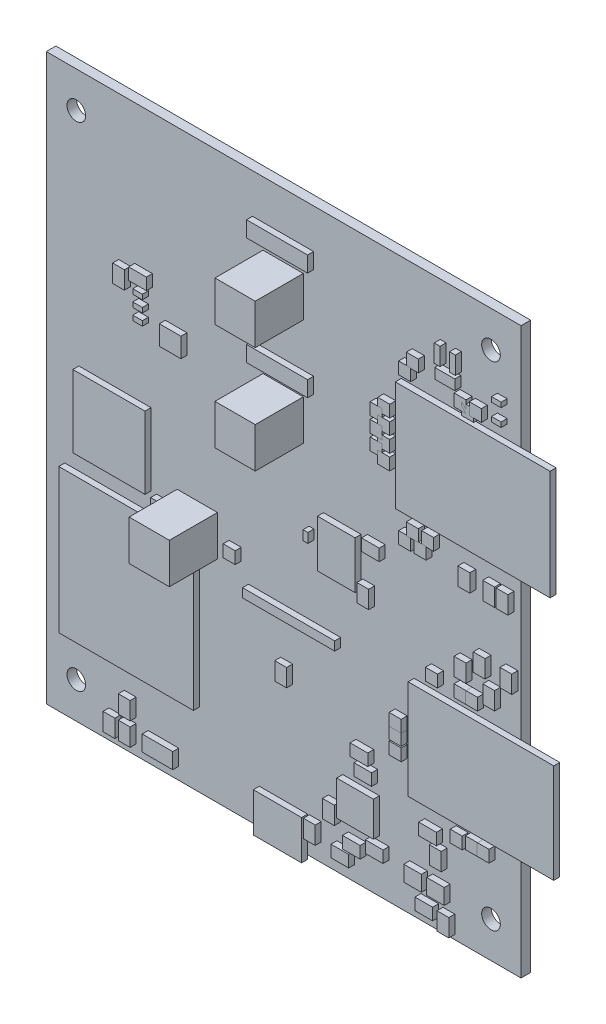
from build123d import *

# Parameters (mm, degrees)
SKETCH1_W                     = 79
SKETCH1_H                     = 94
BOARD_DEPTH                   = 1.6
SKETCH2_W                     = 22.4041
SKETCH2_H                     = 23.9616
BATTCOM_20MM_PTH_KIT_1_DEPTH  = 1
SKETCH3_W                     = 1.6
SKETCH3_H                     = 0.8008
C0603K_1_DEPTH                = 1
SKETCH4_W                     = 0.8008
SKETCH4_H                     = 1.6
C0603K_2_DEPTH                = 1
SKETCH5_W                     = 0.8008
SKETCH5_H                     = 1.6
C0603K_3_DEPTH                = 1
SKETCH6_W                     = 0.8008
SKETCH6_H                     = 1.6
C0603K_4_DEPTH                = 1
SKETCH7_W                     = 0.8008
SKETCH7_H                     = 1.6
C0603K_5_DEPTH                = 1
SKETCH8_W                     = 1.6
SKETCH8_H                     = 0.8008
C0603K_6_DEPTH                = 1
SKETCH9_W                     = 0.966
SKETCH9_H                     = 2.946
EXTRUDE_C0402_1_DEPTH         = 1
SKETCH10_W                    = 0.966
SKETCH10_H                    = 2.946
EXTRUDE_C0402_2_DEPTH         = 1
SKETCH11_W                    = 1.6
SKETCH11_H                    = 0.8008
C0603K_7_DEPTH                = 1
SKETCH12_W                    = 0.8008
SKETCH12_H                    = 1.6
C0603K_8_DEPTH                = 1
SKETCH13_W                    = 0.8008
SKETCH13_H                    = 1.6
C0603K_9_DEPTH                = 1
SKETCH14_W                    = 0.8008
SKETCH14_H                    = 1.6
C0603K_10_DEPTH               = 1
SKETCH15_W                    = 1.6
SKETCH15_H                    = 0.8008
C0603K_11_DEPTH               = 1
SKETCH16_W                    = 6.7016
SKETCH16_H                    = 6.7016
F_153CLV_0605_1_DEPTH         = 8
SKETCH17_W                    = 6.7016
SKETCH17_H                    = 6.7016
F_153CLV_0605_2_DEPTH         = 8
SKETCH18_W                    = 1.6
SKETCH18_H                    = 0.8008
C0603K_12_DEPTH               = 1
SKETCH19_W                    = 0.8008
SKETCH19_H                    = 1.6
C0603K_13_DEPTH               = 1
SKETCH20_W                    = 0.8008
SKETCH20_H                    = 1.6
C0603K_14_DEPTH               = 1
SKETCH21_W                    = 1.6
SKETCH21_H                    = 0.8008
C0603K_15_DEPTH               = 1
SKETCH22_W                    = 0.8008
SKETCH22_H                    = 1.6
C0603K_16_DEPTH               = 1
SKETCH23_W                    = 1.6
SKETCH23_H                    = 0.8008
C0603K_17_DEPTH               = 1
SKETCH24_W                    = 0.8008
SKETCH24_H                    = 1.6
C0603K_18_DEPTH               = 1
SKETCH25_W                    = 6.7016
SKETCH25_H                    = 6.7016
F_153CLV_0605_3_DEPTH         = 8
SKETCH26_W                    = 1.6
SKETCH26_H                    = 0.8008
C0603K_19_DEPTH               = 1
SKETCH27_W                    = 1.6
SKETCH27_H                    = 0.8008
C0603K_20_DEPTH               = 1
SKETCH28_W                    = 1.6
SKETCH28_H                    = 0.8008
C0603K_21_DEPTH               = 1
SKETCH29_W                    = 1.6
SKETCH29_H                    = 0.8008
C0603K_22_DEPTH               = 1
SKETCH30_W                    = 1.6
SKETCH30_H                    = 0.8008
C0603K_23_DEPTH               = 1
SKETCH31_W                    = 0.966
SKETCH31_H                    = 2.946
EXTRUDE_C0402_3_DEPTH         = 1
SKETCH32_W                    = 0.966
SKETCH32_H                    = 2.946
EXTRUDE_C0402_4_DEPTH         = 1
SKETCH33_W                    = 0.8008
SKETCH33_H                    = 1.6
C0603K_24_DEPTH               = 1
SKETCH34_W                    = 5.6242
SKETCH34_H                    = 5.676903
WS2812B_1_DEPTH               = 1
SKETCH35_W                    = 2.921
SKETCH35_H                    = 2.5908
SOT23_1_DEPTH                 = 1
SKETCH36_W                    = 2.921
SKETCH36_H                    = 2.5908
SOT23_2_DEPTH                 = 1
SKETCH37_W                    = 6.10435
SKETCH37_H                    = 5.77935
MLP28_1_DEPTH                 = 1
SKETCH38_W                    = 2.2
SKETCH38_H                    = 2.4032
SC70_5L_1_DEPTH               = 1
SKETCH39_W                    = 15.3416
SKETCH39_H                    = 1.4732
F_1X06_LONGPADS_1_DEPTH       = 1
SKETCH40_W                    = 8.04
SKETCH40_H                    = 6.534
USB_MICROB_PTH_MILL_1_DEPTH   = 1
SKETCH41_W                    = 2.9914
SKETCH41_H                    = 4.9968
L3225M_1_DEPTH                = 1
SKETCH42_W                    = 10.16
SKETCH42_H                    = 2.6162
EXTRUDE_1X04_1_DEPTH          = 1
SKETCH43_W                    = 10.16
SKETCH43_H                    = 2.6162
EXTRUDE_1X04_2_DEPTH          = 1
SKETCH44_W                    = 5.08
SKETCH44_H                    = 2.6162
EXTRUDE_1X02_1_DEPTH          = 1
SKETCH45_W                    = 12.0032
SKETCH45_H                    = 12.0032
BUZZER_12MM_NS_KIT_1_DEPTH    = 1
SKETCH46_W                    = 1.966
SKETCH46_H                    = 2.946
EXTRUDE_R0603_1_DEPTH         = 1
SKETCH47_W                    = 2.946
SKETCH47_H                    = 1.966
EXTRUDE_R0603_2_DEPTH         = 1
SKETCH48_W                    = 2.946
SKETCH48_H                    = 1.966
EXTRUDE_R0603_3_DEPTH         = 1
SKETCH49_W                    = 2.946
SKETCH49_H                    = 1.966
EXTRUDE_R0603_4_DEPTH         = 1
SKETCH50_W                    = 2.946
SKETCH50_H                    = 1.966
EXTRUDE_R0603_5_DEPTH         = 1
SKETCH51_W                    = 2.946
SKETCH51_H                    = 1.966
EXTRUDE_R0603_6_DEPTH         = 1
SKETCH52_W                    = 2.946
SKETCH52_H                    = 1.966
EXTRUDE_R0603_7_DEPTH         = 1
SKETCH53_W                    = 1.966
SKETCH53_H                    = 2.946
EXTRUDE_R0603_8_DEPTH         = 1
SKETCH54_W                    = 1.966
SKETCH54_H                    = 2.946
EXTRUDE_R0603_9_DEPTH         = 1
SKETCH55_W                    = 2.946
SKETCH55_H                    = 1.966
EXTRUDE_R0603_10_DEPTH        = 1
SKETCH56_W                    = 1.966
SKETCH56_H                    = 2.946
EXTRUDE_R0603_11_DEPTH        = 1
SKETCH57_W                    = 1.966
SKETCH57_H                    = 2.946
EXTRUDE_R0603_12_DEPTH        = 1
SKETCH58_W                    = 1.966
SKETCH58_H                    = 2.946
EXTRUDE_R0603_13_DEPTH        = 1
SKETCH59_W                    = 1.966
SKETCH59_H                    = 2.946
EXTRUDE_R0603_14_DEPTH        = 1
SKETCH60_W                    = 1.966
SKETCH60_H                    = 2.946
EXTRUDE_R0603_15_DEPTH        = 1
SKETCH61_W                    = 2.946
SKETCH61_H                    = 1.966
EXTRUDE_R0603_16_DEPTH        = 1
SKETCH62_W                    = 2.946
SKETCH62_H                    = 1.966
EXTRUDE_R0603_17_DEPTH        = 1
SKETCH63_W                    = 1.966
SKETCH63_H                    = 2.946
EXTRUDE_R0603_18_DEPTH        = 1
SKETCH64_W                    = 1.966
SKETCH64_H                    = 2.946
EXTRUDE_R0603_19_DEPTH        = 1
SKETCH65_W                    = 1.966
SKETCH65_H                    = 2.946
EXTRUDE_R0603_20_DEPTH        = 1
SKETCH66_W                    = 1.966
SKETCH66_H                    = 2.946
EXTRUDE_R0603_21_DEPTH        = 1
SKETCH67_W                    = 1.966
SKETCH67_H                    = 2.946
EXTRUDE_R0603_22_DEPTH        = 1
SKETCH68_W                    = 1.966
SKETCH68_H                    = 2.946
EXTRUDE_R0603_23_DEPTH        = 1
SKETCH69_W                    = 1.966
SKETCH69_H                    = 2.946
EXTRUDE_R0603_24_DEPTH        = 1
SKETCH70_W                    = 1.966
SKETCH70_H                    = 2.946
EXTRUDE_R0603_25_DEPTH        = 1
SKETCH71_W                    = 1.966
SKETCH71_H                    = 2.946
EXTRUDE_R0603_26_DEPTH        = 1
SKETCH72_W                    = 2.946
SKETCH72_H                    = 1.966
EXTRUDE_R0603_27_DEPTH        = 1
SKETCH73_W                    = 2.946
SKETCH73_H                    = 1.966
EXTRUDE_R0603_28_DEPTH        = 1
SKETCH74_W                    = 2.946
SKETCH74_H                    = 1.966
EXTRUDE_R0603_29_DEPTH        = 1
SKETCH75_W                    = 2.946
SKETCH75_H                    = 1.966
EXTRUDE_R0603_30_DEPTH        = 1
SKETCH76_W                    = 1.966
SKETCH76_H                    = 2.946
EXTRUDE_R0603_31_DEPTH        = 1
SKETCH77_W                    = 2.946
SKETCH77_H                    = 1.966
EXTRUDE_R0603_32_DEPTH        = 1
SKETCH78_W                    = 2.946
SKETCH78_H                    = 1.966
EXTRUDE_R0603_33_DEPTH        = 1
SKETCH79_W                    = 1.966
SKETCH79_H                    = 2.946
EXTRUDE_R0603_34_DEPTH        = 1
SKETCH80_W                    = 1.966
SKETCH80_H                    = 2.946
EXTRUDE_R0603_35_DEPTH        = 1
SKETCH81_W                    = 2.946
SKETCH81_H                    = 1.966
EXTRUDE_R0603_36_DEPTH        = 1
SKETCH82_W                    = 1.966
SKETCH82_H                    = 2.946
EXTRUDE_R0603_37_DEPTH        = 1
SKETCH83_W                    = 1.966
SKETCH83_H                    = 2.946
EXTRUDE_R0603_38_DEPTH        = 1
SKETCH84_W                    = 2.946
SKETCH84_H                    = 1.966
EXTRUDE_R0603_39_DEPTH        = 1
SKETCH85_W                    = 2.946
SKETCH85_H                    = 1.966
EXTRUDE_R0603_40_DEPTH        = 1
SKETCH86_W                    = 1.966
SKETCH86_H                    = 2.946
EXTRUDE_R0603_41_DEPTH        = 1
SKETCH87_W                    = 1.966
SKETCH87_H                    = 2.946
EXTRUDE_R0603_42_DEPTH        = 1
SKETCH88_W                    = 2.946
SKETCH88_H                    = 1.966
EXTRUDE_R0603_43_DEPTH        = 1
SKETCH89_W                    = 2.946
SKETCH89_H                    = 1.966
EXTRUDE_R0603_44_DEPTH        = 1
SKETCH90_W                    = 1.966
SKETCH90_H                    = 2.946
EXTRUDE_R0603_45_DEPTH        = 1
SKETCH91_W                    = 2.946
SKETCH91_H                    = 1.966
EXTRUDE_R0603_46_DEPTH        = 1
SKETCH92_W                    = 2.946
SKETCH92_H                    = 1.966
EXTRUDE_R0603_47_DEPTH        = 1
SKETCH93_W                    = 2.946
SKETCH93_H                    = 1.966
EXTRUDE_R0603_48_DEPTH        = 1
SKETCH94_W                    = 1.966
SKETCH94_H                    = 2.946
EXTRUDE_R0603_49_DEPTH        = 1
SKETCH95_W                    = 1.966
SKETCH95_H                    = 2.946
EXTRUDE_R0603_50_DEPTH        = 1
SKETCH96_W                    = 1.966
SKETCH96_H                    = 2.946
EXTRUDE_R0603_51_DEPTH        = 1
SKETCH97_W                    = 1.966
SKETCH97_H                    = 2.946
EXTRUDE_R0603_52_DEPTH        = 1
SKETCH98_W                    = 1.966
SKETCH98_H                    = 2.946
EXTRUDE_R0603_53_DEPTH        = 1
SKETCH99_W                    = 1.966
SKETCH99_H                    = 2.946
EXTRUDE_R0603_54_DEPTH        = 1
SKETCH100_W                   = 24.227
SKETCH100_H                   = 16.51
ESP8266_ESP12E_1_DEPTH        = 1
SKETCH101_W                   = 2.921
SKETCH101_H                   = 2.5908
SOT23_3_DEPTH                 = 1
SKETCH102_W                   = 2.921
SKETCH102_H                   = 2.5908
SOT23_4_DEPTH                 = 1
SKETCH103_W                   = 2.921
SKETCH103_H                   = 2.5908
SOT23_5_DEPTH                 = 1
SKETCH104_W                   = 2
SKETCH104_H                   = 2
TP10R_1_DEPTH                 = 1
SKETCH105_W                   = 2
SKETCH105_H                   = 2
TP10R_2_DEPTH                 = 1
SKETCH106_W                   = 2
SKETCH106_H                   = 2
TP10R_3_DEPTH                 = 1
SKETCH107_W                   = 2
SKETCH107_H                   = 2
TP10R_4_DEPTH                 = 1
SKETCH108_W                   = 2
SKETCH108_H                   = 2
TP10R_5_DEPTH                 = 1
SKETCH109_W                   = 2
SKETCH109_H                   = 2
TP10R_6_DEPTH                 = 1
SKETCH110_W                   = 2
SKETCH110_H                   = 2
TP10R_7_DEPTH                 = 1
SKETCH111_W                   = 2
SKETCH111_H                   = 2
TP10R_8_DEPTH                 = 1
SKETCH112_W                   = 2
SKETCH112_H                   = 2
TP10R_9_DEPTH                 = 1
SKETCH113_W                   = 2
SKETCH113_H                   = 2
TP10R_10_DEPTH                = 1
SKETCH114_W                   = 2
SKETCH114_H                   = 2
TP10R_11_DEPTH                = 1
SKETCH115_W                   = 2
SKETCH115_H                   = 2
TP10R_12_DEPTH                = 1
SKETCH116_W                   = 2
SKETCH116_H                   = 2
TP10R_13_DEPTH                = 1
SKETCH117_W                   = 2
SKETCH117_H                   = 2
TP10R_14_DEPTH                = 1
SKETCH118_W                   = 2
SKETCH118_H                   = 2
TP10R_15_DEPTH                = 1
SKETCH119_W                   = 2
SKETCH119_H                   = 2
TP10R_16_DEPTH                = 1
SKETCH120_W                   = 2
SKETCH120_H                   = 2
TP10R_17_DEPTH                = 1
SKETCH121_W                   = 2
SKETCH121_H                   = 2
TP10R_18_DEPTH                = 1
SKETCH122_W                   = 2
SKETCH122_H                   = 2
TP10R_19_DEPTH                = 1
SKETCH123_W                   = 2
SKETCH123_H                   = 2
TP10R_20_DEPTH                = 1
SKETCH124_W                   = 2
SKETCH124_H                   = 2
TP10R_21_DEPTH                = 1
SKETCH125_W                   = 2
SKETCH125_H                   = 2
TP10R_22_DEPTH                = 1
SKETCH126_W                   = 2
SKETCH126_H                   = 2
TP10R_23_DEPTH                = 1
SKETCH127_W                   = 2
SKETCH127_H                   = 2
TP10R_24_DEPTH                = 1
SKETCH128_W                   = 2
SKETCH128_H                   = 2
TP10R_25_DEPTH                = 1
SKETCH129_W                   = 2
SKETCH129_H                   = 2
TP10R_26_DEPTH                = 1
SKETCH130_W                   = 2
SKETCH130_H                   = 2
TP10R_27_DEPTH                = 1
SKETCH131_W                   = 3
SKETCH131_H                   = 2.9464
SOT23_5_1_DEPTH               = 1
SKETCH132_W                   = 5.715
SKETCH132_H                   = 6.1976
SO08_0_15_1_DEPTH             = 1
SKETCH133_W                   = 25.754
SKETCH133_H                   = 18.254
ESP_WROOM_32_1_DEPTH          = 1
SKETCH134_W                   = 11.230556
SKETCH134_H                   = 6.6675
SO016_1_DEPTH                 = 1
SKETCH135_W                   = 6.261
SKETCH135_H                   = 7.9
SOIC_8_1_DEPTH                = 1
SKETCH136_W                   = 3.5889
SKETCH136_H                   = 3.2524
QFN_16_0_5MM_EXTRA_1_DEPTH    = 1
SKETCH137_W                   = 6.096
SKETCH137_H                   = 13.208
HC49UP_1_DEPTH                = 1
SKETCH138_W                   = 3.327
SKETCH138_H                   = 1.7
CRYSTAL_SMD_3_2X1_5MM_1_DEPTH = 1
SKETCH139_W                   = 3.327
SKETCH139_H                   = 1.7
CRYSTAL_SMD_3_2X1_5MM_2_DEPTH = 1
SKETCH140_R                   = 1.55
CUT_EXTRUDE1_DEPTH            = 10


with BuildPart() as part:
    # Sketch1 → BOARD (new body)
    with BuildSketch(Plane.XY):
        with Locations((39.5, 47)):
            Rectangle(SKETCH1_W, SKETCH1_H)
    extrude(amount=BOARD_DEPTH)

    # Sketch140 → Cut-Extrude1 (cut)
    with BuildSketch(Plane.XY.offset(1.6)):
        with Locations((5, 6)):
            Circle(SKETCH140_R)
        with Locations((5, 88)):
            Circle(SKETCH140_R)
        with Locations((74, 6)):
            Circle(SKETCH140_R)
        with Locations((74, 88)):
            Circle(SKETCH140_R)
    extrude(amount=-CUT_EXTRUDE1_DEPTH, mode=Mode.SUBTRACT)


with BuildPart() as body_2:
    # Sketch2 → BATTCOM_20MM_PTH_KIT-1 (new body)
    with BuildSketch(Plane.XY.offset(1.6)):
        with Locations((14.2875, 24.2767)):
            Rectangle(SKETCH2_W, SKETCH2_H)
    extrude(amount=BATTCOM_20MM_PTH_KIT_1_DEPTH)


with BuildPart() as body_3:
    # Sketch3 → C0603K-1 (new body)
    with BuildSketch(Plane.XY):
        with Locations((38.1, 43.1804)):
            Rectangle(SKETCH3_W, SKETCH3_H)
    extrude(amount=-C0603K_1_DEPTH)


with BuildPart() as body_4:
    # Sketch4 → C0603K-2 (new body)
    with BuildSketch(Plane.XY):
        with Locations((34.9254, 24.765)):
            Rectangle(SKETCH4_W, SKETCH4_H)
    extrude(amount=-C0603K_2_DEPTH)


with BuildPart() as body_5:
    # Sketch5 → C0603K-3 (new body)
    with BuildSketch(Plane.XY):
        with Locations((37.1479, 24.765)):
            Rectangle(SKETCH5_W, SKETCH5_H)
    extrude(amount=-C0603K_3_DEPTH)


with BuildPart() as body_6:
    # Sketch6 → C0603K-4 (new body)
    with BuildSketch(Plane.XY):
        with Locations((39.6879, 24.765)):
            Rectangle(SKETCH6_W, SKETCH6_H)
    extrude(amount=-C0603K_4_DEPTH)


with BuildPart() as body_7:
    # Sketch7 → C0603K-5 (new body)
    with BuildSketch(Plane.XY):
        with Locations((41.9104, 24.765)):
            Rectangle(SKETCH7_W, SKETCH7_H)
    extrude(amount=-C0603K_5_DEPTH)


with BuildPart() as body_8:
    # Sketch8 → C0603K-6 (new body)
    with BuildSketch(Plane.XY):
        with Locations((39.37, 88.8996)):
            Rectangle(SKETCH8_W, SKETCH8_H)
    extrude(amount=-C0603K_6_DEPTH)


with BuildPart() as body_9:
    # Sketch9 → Extrude C0402-1 (new body)
    with BuildSketch(Plane.XY):
        with Locations((27.94, 10.4775)):
            Rectangle(SKETCH9_W, SKETCH9_H)
    extrude(amount=-EXTRUDE_C0402_1_DEPTH)


with BuildPart() as body_10:
    # Sketch10 → Extrude C0402-2 (new body)
    with BuildSketch(Plane.XY):
        with Locations((27.94, 18.7325)):
            Rectangle(SKETCH10_W, SKETCH10_H)
    extrude(amount=-EXTRUDE_C0402_2_DEPTH)


with BuildPart() as body_11:
    # Sketch11 → C0603K-7 (new body)
    with BuildSketch(Plane.XY):
        with Locations((39.37, 71.4371)):
            Rectangle(SKETCH11_W, SKETCH11_H)
    extrude(amount=-C0603K_7_DEPTH)


with BuildPart() as body_12:
    # Sketch12 → C0603K-8 (new body)
    with BuildSketch(Plane.XY):
        with Locations((19.3671, 22.5425)):
            Rectangle(SKETCH12_W, SKETCH12_H)
    extrude(amount=-C0603K_8_DEPTH)


with BuildPart() as body_13:
    # Sketch13 → C0603K-9 (new body)
    with BuildSketch(Plane.XY):
        with Locations((65.4046, 29.5275)):
            Rectangle(SKETCH13_W, SKETCH13_H)
    extrude(amount=-C0603K_9_DEPTH)


with BuildPart() as body_14:
    # Sketch14 → C0603K-10 (new body)
    with BuildSketch(Plane.XY):
        with Locations((67.3096, 29.5275)):
            Rectangle(SKETCH14_W, SKETCH14_H)
    extrude(amount=-C0603K_10_DEPTH)


with BuildPart() as body_15:
    # Sketch15 → C0603K-11 (new body)
    with BuildSketch(Plane.XY):
        with Locations((44.1325, 13.3346)):
            Rectangle(SKETCH15_W, SKETCH15_H)
    extrude(amount=-C0603K_11_DEPTH)


with BuildPart() as body_16:
    # Sketch16 → 153CLV-0605-1 (new body)
    with BuildSketch(Plane.XY.offset(1.6)):
        with Locations((39.4208, 62.2808)):
            Rectangle(SKETCH16_W, SKETCH16_H)
    extrude(amount=F_153CLV_0605_1_DEPTH)


with BuildPart() as body_17:
    # Sketch17 → 153CLV-0605-2 (new body)
    with BuildSketch(Plane.XY.offset(1.6)):
        with Locations((39.4208, 80.0608)):
            Rectangle(SKETCH17_W, SKETCH17_H)
    extrude(amount=F_153CLV_0605_2_DEPTH)


with BuildPart() as body_18:
    # Sketch18 → C0603K-12 (new body)
    with BuildSketch(Plane.XY):
        with Locations((66.9925, 21.9079)):
            Rectangle(SKETCH18_W, SKETCH18_H)
    extrude(amount=-C0603K_12_DEPTH)


with BuildPart() as body_19:
    # Sketch19 → C0603K-13 (new body)
    with BuildSketch(Plane.XY.offset(1.6)):
        with Locations((44.1321, 46.6725)):
            Rectangle(SKETCH19_W, SKETCH19_H)
    extrude(amount=C0603K_13_DEPTH)


with BuildPart() as body_20:
    # Sketch20 → C0603K-14 (new body)
    with BuildSketch(Plane.XY):
        with Locations((5.7154, 55.245)):
            Rectangle(SKETCH20_W, SKETCH20_H)
    extrude(amount=-C0603K_14_DEPTH)


with BuildPart() as body_21:
    # Sketch21 → C0603K-15 (new body)
    with BuildSketch(Plane.XY):
        with Locations((6.985, 58.1029)):
            Rectangle(SKETCH21_W, SKETCH21_H)
    extrude(amount=-C0603K_15_DEPTH)


with BuildPart() as body_22:
    # Sketch22 → C0603K-16 (new body)
    with BuildSketch(Plane.XY):
        with Locations((14.6054, 53.34)):
            Rectangle(SKETCH22_W, SKETCH22_H)
    extrude(amount=-C0603K_16_DEPTH)


with BuildPart() as body_23:
    # Sketch23 → C0603K-17 (new body)
    with BuildSketch(Plane.XY):
        with Locations((25.0825, 39.6871)):
            Rectangle(SKETCH23_W, SKETCH23_H)
    extrude(amount=-C0603K_17_DEPTH)


with BuildPart() as body_24:
    # Sketch24 → C0603K-18 (new body)
    with BuildSketch(Plane.XY):
        with Locations((28.2571, 42.2275)):
            Rectangle(SKETCH24_W, SKETCH24_H)
    extrude(amount=-C0603K_18_DEPTH)


with BuildPart() as body_25:
    # Sketch25 → 153CLV-0605-3 (new body)
    with BuildSketch(Plane.XY.offset(1.6)):
        with Locations((25.1333, 38.4683)):
            Rectangle(SKETCH25_W, SKETCH25_H)
    extrude(amount=F_153CLV_0605_3_DEPTH)


with BuildPart() as body_26:
    # Sketch26 → C0603K-19 (new body)
    with BuildSketch(Plane.XY.offset(1.6)):
        with Locations((75.8825, 79.0579)):
            Rectangle(SKETCH26_W, SKETCH26_H)
    extrude(amount=C0603K_19_DEPTH)


with BuildPart() as body_27:
    # Sketch27 → C0603K-20 (new body)
    with BuildSketch(Plane.XY.offset(1.6)):
        with Locations((75.8825, 81.9154)):
            Rectangle(SKETCH27_W, SKETCH27_H)
    extrude(amount=C0603K_20_DEPTH)


with BuildPart() as body_28:
    # Sketch28 → C0603K-21 (new body)
    with BuildSketch(Plane.XY.offset(1.6)):
        with Locations((16.1925, 63.8171)):
            Rectangle(SKETCH28_W, SKETCH28_H)
    extrude(amount=C0603K_21_DEPTH)


with BuildPart() as body_29:
    # Sketch29 → C0603K-22 (new body)
    with BuildSketch(Plane.XY.offset(1.6)):
        with Locations((16.1925, 65.7221)):
            Rectangle(SKETCH29_W, SKETCH29_H)
    extrude(amount=C0603K_22_DEPTH)


with BuildPart() as body_30:
    # Sketch30 → C0603K-23 (new body)
    with BuildSketch(Plane.XY.offset(1.6)):
        with Locations((16.1925, 67.6271)):
            Rectangle(SKETCH30_W, SKETCH30_H)
    extrude(amount=C0603K_23_DEPTH)


with BuildPart() as body_31:
    # Sketch31 → Extrude C0402-3 (new body)
    with BuildSketch(Plane.XY.offset(1.6)):
        with Locations((66.04, 83.82)):
            Rectangle(SKETCH31_W, SKETCH31_H)
    extrude(amount=EXTRUDE_C0402_3_DEPTH)


with BuildPart() as body_32:
    # Sketch32 → Extrude C0402-4 (new body)
    with BuildSketch(Plane.XY.offset(1.6)):
        with Locations((68.58, 83.82)):
            Rectangle(SKETCH32_W, SKETCH32_H)
    extrude(amount=EXTRUDE_C0402_4_DEPTH)


with BuildPart() as body_33:
    # Sketch33 → C0603K-24 (new body)
    with BuildSketch(Plane.XY):
        with Locations((66.0404, 25.0825)):
            Rectangle(SKETCH33_W, SKETCH33_H)
    extrude(amount=-C0603K_24_DEPTH)


with BuildPart() as body_34:
    # Sketch34 → WS2812B-1 (new body)
    with BuildSketch(Plane.XY):
        with Locations((39.6186, 47.2122485)):
            Rectangle(SKETCH34_W, SKETCH34_H)
    extrude(amount=-WS2812B_1_DEPTH)


with BuildPart() as body_35:
    # Sketch35 → SOT23-1 (new body)
    with BuildSketch(Plane.XY):
        with Locations((39.3319, 40.3225)):
            Rectangle(SKETCH35_W, SKETCH35_H)
    extrude(amount=-SOT23_1_DEPTH)


with BuildPart() as body_36:
    # Sketch36 → SOT23-2 (new body)
    with BuildSketch(Plane.XY):
        with Locations((47.0281, 22.86)):
            Rectangle(SKETCH36_W, SKETCH36_H)
    extrude(amount=-SOT23_2_DEPTH)


with BuildPart() as body_37:
    # Sketch37 → MLP28-1 (new body)
    with BuildSketch(Plane.XY.offset(1.6)):
        with Locations((52.385325, 11.594675)):
            Rectangle(SKETCH37_W, SKETCH37_H)
    extrude(amount=MLP28_1_DEPTH)


with BuildPart() as body_38:
    # Sketch38 → SC70-5L-1 (new body)
    with BuildSketch(Plane.XY):
        with Locations((11.43, 53.34)):
            Rectangle(SKETCH38_W, SKETCH38_H)
    extrude(amount=-SC70_5L_1_DEPTH)


with BuildPart() as body_39:
    # Sketch39 → 1X06_LONGPADS-1 (new body)
    with BuildSketch(Plane.XY.offset(1.6)):
        with Locations((41.3258, 33.3375)):
            Rectangle(SKETCH39_W, SKETCH39_H)
    extrude(amount=F_1X06_LONGPADS_1_DEPTH)


with BuildPart() as body_40:
    # Sketch40 → USB-MICROB-PTH-MILL-1 (new body)
    with BuildSketch(Plane.XY.offset(1.6)):
        with Locations((39.468428, 2.596341)):
            Rectangle(SKETCH40_W, SKETCH40_H)
    extrude(amount=USB_MICROB_PTH_MILL_1_DEPTH)


with BuildPart() as body_41:
    # Sketch41 → L3225M-1 (new body)
    with BuildSketch(Plane.XY):
        with Locations((20.6248, 42.2275)):
            Rectangle(SKETCH41_W, SKETCH41_H)
    extrude(amount=-L3225M_1_DEPTH)


with BuildPart() as body_42:
    # Sketch42 → Extrude 1X04-1 (new body)
    with BuildSketch(Plane.XY.offset(1.6)):
        with Locations((39.403706, 68.150384)):
            Rectangle(SKETCH42_W, SKETCH42_H)
    extrude(amount=EXTRUDE_1X04_1_DEPTH)


with BuildPart() as body_43:
    # Sketch43 → Extrude 1X04-2 (new body)
    with BuildSketch(Plane.XY.offset(1.6)):
        with Locations((39.403159, 86.1172)):
            Rectangle(SKETCH43_W, SKETCH43_H)
    extrude(amount=EXTRUDE_1X04_2_DEPTH)


with BuildPart() as body_44:
    # Sketch44 → Extrude 1X02-1 (new body)
    with BuildSketch(Plane.XY.offset(1.6)):
        with Locations((19.502516, 3.337603)):
            Rectangle(SKETCH44_W, SKETCH44_H)
    extrude(amount=EXTRUDE_1X02_1_DEPTH)


with BuildPart() as body_45:
    # Sketch45 → BUZZER-12MM-NS-KIT-1 (new body)
    with BuildSketch(Plane.XY.offset(1.6)):
        with Locations((11.43, 45.4025)):
            Rectangle(SKETCH45_W, SKETCH45_H)
    extrude(amount=BUZZER_12MM_NS_KIT_1_DEPTH)


with BuildPart() as body_46:
    # Sketch46 → Extrude R0603-1 (new body)
    with BuildSketch(Plane.XY.offset(1.6)):
        with Locations((66.9925, 2.2225)):
            Rectangle(SKETCH46_W, SKETCH46_H)
    extrude(amount=EXTRUDE_R0603_1_DEPTH)


with BuildPart() as body_47:
    # Sketch47 → Extrude R0603-2 (new body)
    with BuildSketch(Plane.XY.offset(1.6)):
        with Locations((63.8175, 2.8575)):
            Rectangle(SKETCH47_W, SKETCH47_H)
    extrude(amount=EXTRUDE_R0603_2_DEPTH)


with BuildPart() as body_48:
    # Sketch48 → Extrude R0603-3 (new body)
    with BuildSketch(Plane.XY.offset(1.6)):
        with Locations((53.0225, 19.685)):
            Rectangle(SKETCH48_W, SKETCH48_H)
    extrude(amount=EXTRUDE_R0603_3_DEPTH)


with BuildPart() as body_49:
    # Sketch49 → Extrude R0603-4 (new body)
    with BuildSketch(Plane.XY.offset(1.6)):
        with Locations((53.6575, 17.145)):
            Rectangle(SKETCH49_W, SKETCH49_H)
    extrude(amount=EXTRUDE_R0603_4_DEPTH)


with BuildPart() as body_50:
    # Sketch50 → Extrude R0603-5 (new body)
    with BuildSketch(Plane.XY):
        with Locations((41.275, 11.43)):
            Rectangle(SKETCH50_W, SKETCH50_H)
    extrude(amount=-EXTRUDE_R0603_5_DEPTH)


with BuildPart() as body_51:
    # Sketch51 → Extrude R0603-6 (new body)
    with BuildSketch(Plane.XY):
        with Locations((37.1475, 11.43)):
            Rectangle(SKETCH51_W, SKETCH51_H)
    extrude(amount=-EXTRUDE_R0603_6_DEPTH)


with BuildPart() as body_52:
    # Sketch52 → Extrude R0603-7 (new body)
    with BuildSketch(Plane.XY):
        with Locations((47.9425, 17.145)):
            Rectangle(SKETCH52_W, SKETCH52_H)
    extrude(amount=-EXTRUDE_R0603_7_DEPTH)


with BuildPart() as body_53:
    # Sketch53 → Extrude R0603-8 (new body)
    with BuildSketch(Plane.XY):
        with Locations((40.3225, 12.3825)):
            Rectangle(SKETCH53_W, SKETCH53_H)
    extrude(amount=-EXTRUDE_R0603_8_DEPTH)


with BuildPart() as body_54:
    # Sketch54 → Extrude R0603-9 (new body)
    with BuildSketch(Plane.XY):
        with Locations((38.1, 12.3825)):
            Rectangle(SKETCH54_W, SKETCH54_H)
    extrude(amount=-EXTRUDE_R0603_9_DEPTH)


with BuildPart() as body_55:
    # Sketch55 → Extrude R0603-10 (new body)
    with BuildSketch(Plane.XY):
        with Locations((47.9425, 19.685)):
            Rectangle(SKETCH55_W, SKETCH55_H)
    extrude(amount=-EXTRUDE_R0603_10_DEPTH)


with BuildPart() as body_56:
    # Sketch56 → Extrude R0603-11 (new body)
    with BuildSketch(Plane.XY.offset(1.6)):
        with Locations((40.005, 24.765)):
            Rectangle(SKETCH56_W, SKETCH56_H)
    extrude(amount=EXTRUDE_R0603_11_DEPTH)


with BuildPart() as body_57:
    # Sketch57 → Extrude R0603-12 (new body)
    with BuildSketch(Plane.XY):
        with Locations((76.835, 22.86)):
            Rectangle(SKETCH57_W, SKETCH57_H)
    extrude(amount=-EXTRUDE_R0603_12_DEPTH)


with BuildPart() as body_58:
    # Sketch58 → Extrude R0603-13 (new body)
    with BuildSketch(Plane.XY):
        with Locations((74.295, 22.86)):
            Rectangle(SKETCH58_W, SKETCH58_H)
    extrude(amount=-EXTRUDE_R0603_13_DEPTH)


with BuildPart() as body_59:
    # Sketch59 → Extrude R0603-14 (new body)
    with BuildSketch(Plane.XY.offset(1.6)):
        with Locations((74.6125, 38.735)):
            Rectangle(SKETCH59_W, SKETCH59_H)
    extrude(amount=EXTRUDE_R0603_14_DEPTH)


with BuildPart() as body_60:
    # Sketch60 → Extrude R0603-15 (new body)
    with BuildSketch(Plane.XY):
        with Locations((68.2625, 25.0825)):
            Rectangle(SKETCH60_W, SKETCH60_H)
    extrude(amount=-EXTRUDE_R0603_15_DEPTH)


with BuildPart() as body_61:
    # Sketch61 → Extrude R0603-16 (new body)
    with BuildSketch(Plane.XY):
        with Locations((16.1925, 28.2575)):
            Rectangle(SKETCH61_W, SKETCH61_H)
    extrude(amount=-EXTRUDE_R0603_16_DEPTH)


with BuildPart() as body_62:
    # Sketch62 → Extrude R0603-17 (new body)
    with BuildSketch(Plane.XY.offset(1.6)):
        with Locations((54.9275, 50.165)):
            Rectangle(SKETCH62_W, SKETCH62_H)
    extrude(amount=EXTRUDE_R0603_17_DEPTH)


with BuildPart() as body_63:
    # Sketch63 → Extrude R0603-18 (new body)
    with BuildSketch(Plane.XY.offset(1.6)):
        with Locations((11.43, 3.175)):
            Rectangle(SKETCH63_W, SKETCH63_H)
    extrude(amount=EXTRUDE_R0603_18_DEPTH)


with BuildPart() as body_64:
    # Sketch64 → Extrude R0603-19 (new body)
    with BuildSketch(Plane.XY.offset(1.6)):
        with Locations((13.97, 6.985)):
            Rectangle(SKETCH64_W, SKETCH64_H)
    extrude(amount=EXTRUDE_R0603_19_DEPTH)


with BuildPart() as body_65:
    # Sketch65 → Extrude R0603-20 (new body)
    with BuildSketch(Plane.XY.offset(1.6)):
        with Locations((13.97, 3.175)):
            Rectangle(SKETCH65_W, SKETCH65_H)
    extrude(amount=EXTRUDE_R0603_20_DEPTH)


with BuildPart() as body_66:
    # Sketch66 → Extrude R0603-21 (new body)
    with BuildSketch(Plane.XY.offset(1.6)):
        with Locations((44.7675, 4.445)):
            Rectangle(SKETCH66_W, SKETCH66_H)
    extrude(amount=EXTRUDE_R0603_21_DEPTH)


with BuildPart() as body_67:
    # Sketch67 → Extrude R0603-22 (new body)
    with BuildSketch(Plane.XY):
        with Locations((36.5125, 40.005)):
            Rectangle(SKETCH67_W, SKETCH67_H)
    extrude(amount=-EXTRUDE_R0603_22_DEPTH)


with BuildPart() as body_68:
    # Sketch68 → Extrude R0603-23 (new body)
    with BuildSketch(Plane.XY):
        with Locations((36.83, 51.7525)):
            Rectangle(SKETCH68_W, SKETCH68_H)
    extrude(amount=-EXTRUDE_R0603_23_DEPTH)


with BuildPart() as body_69:
    # Sketch69 → Extrude R0603-24 (new body)
    with BuildSketch(Plane.XY):
        with Locations((39.37, 76.2)):
            Rectangle(SKETCH69_W, SKETCH69_H)
    extrude(amount=-EXTRUDE_R0603_24_DEPTH)


with BuildPart() as body_70:
    # Sketch70 → Extrude R0603-25 (new body)
    with BuildSketch(Plane.XY.offset(1.6)):
        with Locations((77.47, 42.545)):
            Rectangle(SKETCH70_W, SKETCH70_H)
    extrude(amount=EXTRUDE_R0603_25_DEPTH)


with BuildPart() as body_71:
    # Sketch71 → Extrude R0603-26 (new body)
    with BuildSketch(Plane.XY.offset(1.6)):
        with Locations((73.025, 42.545)):
            Rectangle(SKETCH71_W, SKETCH71_H)
    extrude(amount=EXTRUDE_R0603_26_DEPTH)


with BuildPart() as body_72:
    # Sketch72 → Extrude R0603-27 (new body)
    with BuildSketch(Plane.XY):
        with Locations((72.7075, 27.6225)):
            Rectangle(SKETCH72_W, SKETCH72_H)
    extrude(amount=-EXTRUDE_R0603_27_DEPTH)


with BuildPart() as body_73:
    # Sketch73 → Extrude R0603-28 (new body)
    with BuildSketch(Plane.XY):
        with Locations((68.2625, 33.02)):
            Rectangle(SKETCH73_W, SKETCH73_H)
    extrude(amount=-EXTRUDE_R0603_28_DEPTH)


with BuildPart() as body_74:
    # Sketch74 → Extrude R0603-29 (new body)
    with BuildSketch(Plane.XY):
        with Locations((72.7075, 30.1625)):
            Rectangle(SKETCH74_W, SKETCH74_H)
    extrude(amount=-EXTRUDE_R0603_29_DEPTH)


with BuildPart() as body_75:
    # Sketch75 → Extrude R0603-30 (new body)
    with BuildSketch(Plane.XY.offset(1.6)):
        with Locations((64.4525, 13.97)):
            Rectangle(SKETCH75_W, SKETCH75_H)
    extrude(amount=EXTRUDE_R0603_30_DEPTH)


with BuildPart() as body_76:
    # Sketch76 → Extrude R0603-31 (new body)
    with BuildSketch(Plane.XY.offset(1.6)):
        with Locations((69.85, 40.3225)):
            Rectangle(SKETCH76_W, SKETCH76_H)
    extrude(amount=EXTRUDE_R0603_31_DEPTH)


with BuildPart() as body_77:
    # Sketch77 → Extrude R0603-32 (new body)
    with BuildSketch(Plane.XY):
        with Locations((13.97, 50.165)):
            Rectangle(SKETCH77_W, SKETCH77_H)
    extrude(amount=-EXTRUDE_R0603_32_DEPTH)


with BuildPart() as body_78:
    # Sketch78 → Extrude R0603-33 (new body)
    with BuildSketch(Plane.XY):
        with Locations((6.985, 60.6425)):
            Rectangle(SKETCH78_W, SKETCH78_H)
    extrude(amount=-EXTRUDE_R0603_33_DEPTH)


with BuildPart() as body_79:
    # Sketch79 → Extrude R0603-34 (new body)
    with BuildSketch(Plane.XY):
        with Locations((10.795, 50.165)):
            Rectangle(SKETCH79_W, SKETCH79_H)
    extrude(amount=-EXTRUDE_R0603_34_DEPTH)


with BuildPart() as body_80:
    # Sketch80 → Extrude R0603-35 (new body)
    with BuildSketch(Plane.XY):
        with Locations((8.255, 52.07)):
            Rectangle(SKETCH80_W, SKETCH80_H)
    extrude(amount=-EXTRUDE_R0603_35_DEPTH)


with BuildPart() as body_81:
    # Sketch81 → Extrude R0603-36 (new body)
    with BuildSketch(Plane.XY):
        with Locations((11.43, 55.88)):
            Rectangle(SKETCH81_W, SKETCH81_H)
    extrude(amount=-EXTRUDE_R0603_36_DEPTH)


with BuildPart() as body_82:
    # Sketch82 → Extrude R0603-37 (new body)
    with BuildSketch(Plane.XY):
        with Locations((8.255, 55.245)):
            Rectangle(SKETCH82_W, SKETCH82_H)
    extrude(amount=-EXTRUDE_R0603_37_DEPTH)


with BuildPart() as body_83:
    # Sketch83 → Extrude R0603-38 (new body)
    with BuildSketch(Plane.XY):
        with Locations((8.255, 40.3225)):
            Rectangle(SKETCH83_W, SKETCH83_H)
    extrude(amount=-EXTRUDE_R0603_38_DEPTH)


with BuildPart() as body_84:
    # Sketch84 → Extrude R0603-39 (new body)
    with BuildSketch(Plane.XY):
        with Locations((8.89, 36.5125)):
            Rectangle(SKETCH84_W, SKETCH84_H)
    extrude(amount=-EXTRUDE_R0603_39_DEPTH)


with BuildPart() as body_85:
    # Sketch85 → Extrude R0603-40 (new body)
    with BuildSketch(Plane.XY.offset(1.6)):
        with Locations((55.5625, 6.985)):
            Rectangle(SKETCH85_W, SKETCH85_H)
    extrude(amount=EXTRUDE_R0603_40_DEPTH)


with BuildPart() as body_86:
    # Sketch86 → Extrude R0603-41 (new body)
    with BuildSketch(Plane.XY):
        with Locations((30.1625, 42.2275)):
            Rectangle(SKETCH86_W, SKETCH86_H)
    extrude(amount=-EXTRUDE_R0603_41_DEPTH)


with BuildPart() as body_87:
    # Sketch87 → Extrude R0603-42 (new body)
    with BuildSketch(Plane.XY.offset(1.6)):
        with Locations((47.9425, 8.89)):
            Rectangle(SKETCH87_W, SKETCH87_H)
    extrude(amount=EXTRUDE_R0603_42_DEPTH)


with BuildPart() as body_88:
    # Sketch88 → Extrude R0603-43 (new body)
    with BuildSketch(Plane.XY.offset(1.6)):
        with Locations((51.7525, 5.715)):
            Rectangle(SKETCH88_W, SKETCH88_H)
    extrude(amount=EXTRUDE_R0603_43_DEPTH)


with BuildPart() as body_89:
    # Sketch89 → Extrude R0603-44 (new body)
    with BuildSketch(Plane.XY.offset(1.6)):
        with Locations((49.8475, 3.4925)):
            Rectangle(SKETCH89_W, SKETCH89_H)
    extrude(amount=EXTRUDE_R0603_44_DEPTH)


with BuildPart() as body_90:
    # Sketch90 → Extrude R0603-45 (new body)
    with BuildSketch(Plane.XY.offset(1.6)):
        with Locations((13.0175, 68.58)):
            Rectangle(SKETCH90_W, SKETCH90_H)
    extrude(amount=EXTRUDE_R0603_45_DEPTH)


with BuildPart() as body_91:
    # Sketch91 → Extrude R0603-46 (new body)
    with BuildSketch(Plane.XY.offset(1.6)):
        with Locations((16.1925, 69.85)):
            Rectangle(SKETCH91_W, SKETCH91_H)
    extrude(amount=EXTRUDE_R0603_46_DEPTH)


with BuildPart() as body_92:
    # Sketch92 → Extrude R0603-47 (new body)
    with BuildSketch(Plane.XY):
        with Locations((63.8175, 64.135)):
            Rectangle(SKETCH92_W, SKETCH92_H)
    extrude(amount=-EXTRUDE_R0603_47_DEPTH)


with BuildPart() as body_93:
    # Sketch93 → Extrude R0603-48 (new body)
    with BuildSketch(Plane.XY):
        with Locations((63.8175, 61.595)):
            Rectangle(SKETCH93_W, SKETCH93_H)
    extrude(amount=-EXTRUDE_R0603_48_DEPTH)


with BuildPart() as body_94:
    # Sketch94 → Extrude R0603-49 (new body)
    with BuildSketch(Plane.XY):
        with Locations((66.9925, 61.9125)):
            Rectangle(SKETCH94_W, SKETCH94_H)
    extrude(amount=-EXTRUDE_R0603_49_DEPTH)


with BuildPart() as body_95:
    # Sketch95 → Extrude R0603-50 (new body)
    with BuildSketch(Plane.XY.offset(1.6)):
        with Locations((70.485, 53.6575)):
            Rectangle(SKETCH95_W, SKETCH95_H)
    extrude(amount=EXTRUDE_R0603_50_DEPTH)


with BuildPart() as body_96:
    # Sketch96 → Extrude R0603-51 (new body)
    with BuildSketch(Plane.XY.offset(1.6)):
        with Locations((74.6125, 53.6575)):
            Rectangle(SKETCH96_W, SKETCH96_H)
    extrude(amount=EXTRUDE_R0603_51_DEPTH)


with BuildPart() as body_97:
    # Sketch97 → Extrude R0603-52 (new body)
    with BuildSketch(Plane.XY.offset(1.6)):
        with Locations((76.835, 53.6575)):
            Rectangle(SKETCH97_W, SKETCH97_H)
    extrude(amount=EXTRUDE_R0603_52_DEPTH)


with BuildPart() as body_98:
    # Sketch98 → Extrude R0603-53 (new body)
    with BuildSketch(Plane.XY.offset(1.6)):
        with Locations((53.6575, 42.8625)):
            Rectangle(SKETCH98_W, SKETCH98_H)
    extrude(amount=EXTRUDE_R0603_53_DEPTH)


with BuildPart() as body_99:
    # Sketch99 → Extrude R0603-54 (new body)
    with BuildSketch(Plane.XY.offset(1.6)):
        with Locations((65.7225, 11.1125)):
            Rectangle(SKETCH99_W, SKETCH99_H)
    extrude(amount=EXTRUDE_R0603_54_DEPTH)


with BuildPart() as body_100:
    # Sketch100 → ESP8266-ESP12E-1 (new body)
    with BuildSketch(Plane.XY.offset(1.6)):
        with Locations((73.3275, 26.035)):
            Rectangle(SKETCH100_W, SKETCH100_H)
    extrude(amount=ESP8266_ESP12E_1_DEPTH)


with BuildPart() as body_101:
    # Sketch101 → SOT23-3 (new body)
    with BuildSketch(Plane.XY.offset(1.6)):
        with Locations((65.7606, 6.35)):
            Rectangle(SKETCH101_W, SKETCH101_H)
    extrude(amount=SOT23_3_DEPTH)


with BuildPart() as body_102:
    # Sketch102 → SOT23-4 (new body)
    with BuildSketch(Plane.XY.offset(1.6)):
        with Locations((61.9506, 6.35)):
            Rectangle(SKETCH102_W, SKETCH102_H)
    extrude(amount=SOT23_4_DEPTH)


with BuildPart() as body_103:
    # Sketch103 → SOT23-5 (new body)
    with BuildSketch(Plane.XY):
        with Locations((10.7569, 40.3225)):
            Rectangle(SKETCH103_W, SKETCH103_H)
    extrude(amount=-SOT23_5_DEPTH)


with BuildPart() as body_104:
    # Sketch104 → TP10R-1 (new body)
    with BuildSketch(Plane.XY.offset(1.6)):
        with Locations((71.755, 36.83)):
            Rectangle(SKETCH104_W, SKETCH104_H)
    extrude(amount=TP10R_1_DEPTH)


with BuildPart() as body_105:
    # Sketch105 → TP10R-2 (new body)
    with BuildSketch(Plane.XY.offset(1.6)):
        with Locations((73.66, 15.875)):
            Rectangle(SKETCH105_W, SKETCH105_H)
    extrude(amount=TP10R_2_DEPTH)


with BuildPart() as body_106:
    # Sketch106 → TP10R-3 (new body)
    with BuildSketch(Plane.XY.offset(1.6)):
        with Locations((69.85, 36.83)):
            Rectangle(SKETCH106_W, SKETCH106_H)
    extrude(amount=TP10R_3_DEPTH)


with BuildPart() as body_107:
    # Sketch107 → TP10R-4 (new body)
    with BuildSketch(Plane.XY.offset(1.6)):
        with Locations((65.0875, 36.83)):
            Rectangle(SKETCH107_W, SKETCH107_H)
    extrude(amount=TP10R_4_DEPTH)


with BuildPart() as body_108:
    # Sketch108 → TP10R-5 (new body)
    with BuildSketch(Plane.XY.offset(1.6)):
        with Locations((59.055, 23.1775)):
            Rectangle(SKETCH108_W, SKETCH108_H)
    extrude(amount=TP10R_5_DEPTH)


with BuildPart() as body_109:
    # Sketch109 → TP10R-6 (new body)
    with BuildSketch(Plane.XY.offset(1.6)):
        with Locations((69.215, 15.5575)):
            Rectangle(SKETCH109_W, SKETCH109_H)
    extrude(amount=TP10R_6_DEPTH)


with BuildPart() as body_110:
    # Sketch110 → TP10R-7 (new body)
    with BuildSketch(Plane.XY.offset(1.6)):
        with Locations((59.055, 27.305)):
            Rectangle(SKETCH110_W, SKETCH110_H)
    extrude(amount=TP10R_7_DEPTH)


with BuildPart() as body_111:
    # Sketch111 → TP10R-8 (new body)
    with BuildSketch(Plane.XY.offset(1.6)):
        with Locations((59.055, 25.4)):
            Rectangle(SKETCH111_W, SKETCH111_H)
    extrude(amount=TP10R_8_DEPTH)


with BuildPart() as body_112:
    # Sketch112 → TP10R-9 (new body)
    with BuildSketch(Plane.XY.offset(1.6)):
        with Locations((71.755, 15.875)):
            Rectangle(SKETCH112_W, SKETCH112_H)
    extrude(amount=TP10R_9_DEPTH)


with BuildPart() as body_113:
    # Sketch113 → TP10R-10 (new body)
    with BuildSketch(Plane.XY.offset(1.6)):
        with Locations((60.6425, 78.74)):
            Rectangle(SKETCH113_W, SKETCH113_H)
    extrude(amount=TP10R_10_DEPTH)


with BuildPart() as body_114:
    # Sketch114 → TP10R-11 (new body)
    with BuildSketch(Plane.XY.offset(1.6)):
        with Locations((19.3675, 38.4175)):
            Rectangle(SKETCH114_W, SKETCH114_H)
    extrude(amount=TP10R_11_DEPTH)


with BuildPart() as body_115:
    # Sketch115 → TP10R-12 (new body)
    with BuildSketch(Plane.XY.offset(1.6)):
        with Locations((57.15, 71.755)):
            Rectangle(SKETCH115_W, SKETCH115_H)
    extrude(amount=TP10R_12_DEPTH)


with BuildPart() as body_116:
    # Sketch116 → TP10R-13 (new body)
    with BuildSketch(Plane.XY.offset(1.6)):
        with Locations((31.4325, 37.7825)):
            Rectangle(SKETCH116_W, SKETCH116_H)
    extrude(amount=TP10R_13_DEPTH)


with BuildPart() as body_117:
    # Sketch117 → TP10R-14 (new body)
    with BuildSketch(Plane.XY.offset(1.6)):
        with Locations((69.85, 78.74)):
            Rectangle(SKETCH117_W, SKETCH117_H)
    extrude(amount=TP10R_14_DEPTH)


with BuildPart() as body_118:
    # Sketch118 → TP10R-15 (new body)
    with BuildSketch(Plane.XY.offset(1.6)):
        with Locations((71.12, 78.105)):
            Rectangle(SKETCH118_W, SKETCH118_H)
    extrude(amount=TP10R_15_DEPTH)


with BuildPart() as body_119:
    # Sketch119 → TP10R-16 (new body)
    with BuildSketch(Plane.XY.offset(1.6)):
        with Locations((72.39, 78.74)):
            Rectangle(SKETCH119_W, SKETCH119_H)
    extrude(amount=TP10R_16_DEPTH)


with BuildPart() as body_120:
    # Sketch120 → TP10R-17 (new body)
    with BuildSketch(Plane.XY.offset(1.6)):
        with Locations((61.9125, 56.1975)):
            Rectangle(SKETCH120_W, SKETCH120_H)
    extrude(amount=TP10R_17_DEPTH)


with BuildPart() as body_121:
    # Sketch121 → TP10R-18 (new body)
    with BuildSketch(Plane.XY.offset(1.6)):
        with Locations((55.88, 70.485)):
            Rectangle(SKETCH121_W, SKETCH121_H)
    extrude(amount=TP10R_18_DEPTH)


with BuildPart() as body_122:
    # Sketch122 → TP10R-19 (new body)
    with BuildSketch(Plane.XY.offset(1.6)):
        with Locations((57.15, 69.215)):
            Rectangle(SKETCH122_W, SKETCH122_H)
    extrude(amount=TP10R_19_DEPTH)


with BuildPart() as body_123:
    # Sketch123 → TP10R-20 (new body)
    with BuildSketch(Plane.XY.offset(1.6)):
        with Locations((55.88, 67.945)):
            Rectangle(SKETCH123_W, SKETCH123_H)
    extrude(amount=TP10R_20_DEPTH)


with BuildPart() as body_124:
    # Sketch124 → TP10R-21 (new body)
    with BuildSketch(Plane.XY.offset(1.6)):
        with Locations((57.15, 66.675)):
            Rectangle(SKETCH124_W, SKETCH124_H)
    extrude(amount=TP10R_21_DEPTH)


with BuildPart() as body_125:
    # Sketch125 → TP10R-22 (new body)
    with BuildSketch(Plane.XY.offset(1.6)):
        with Locations((55.88, 65.405)):
            Rectangle(SKETCH125_W, SKETCH125_H)
    extrude(amount=TP10R_22_DEPTH)


with BuildPart() as body_126:
    # Sketch126 → TP10R-23 (new body)
    with BuildSketch(Plane.XY.offset(1.6)):
        with Locations((57.15, 64.135)):
            Rectangle(SKETCH126_W, SKETCH126_H)
    extrude(amount=TP10R_23_DEPTH)


with BuildPart() as body_127:
    # Sketch127 → TP10R-24 (new body)
    with BuildSketch(Plane.XY.offset(1.6)):
        with Locations((61.9125, 80.645)):
            Rectangle(SKETCH127_W, SKETCH127_H)
    extrude(amount=TP10R_24_DEPTH)


with BuildPart() as body_128:
    # Sketch128 → TP10R-25 (new body)
    with BuildSketch(Plane.XY.offset(1.6)):
        with Locations((63.1825, 54.2925)):
            Rectangle(SKETCH128_W, SKETCH128_H)
    extrude(amount=TP10R_25_DEPTH)


with BuildPart() as body_129:
    # Sketch129 → TP10R-26 (new body)
    with BuildSketch(Plane.XY.offset(1.6)):
        with Locations((64.4525, 56.1975)):
            Rectangle(SKETCH129_W, SKETCH129_H)
    extrude(amount=TP10R_26_DEPTH)


with BuildPart() as body_130:
    # Sketch130 → TP10R-27 (new body)
    with BuildSketch(Plane.XY.offset(1.6)):
        with Locations((60.6425, 54.2925)):
            Rectangle(SKETCH130_W, SKETCH130_H)
    extrude(amount=TP10R_27_DEPTH)


with BuildPart() as body_131:
    # Sketch131 → SOT23-5-1 (new body)
    with BuildSketch(Plane.XY):
        with Locations((25.0825, 42.1767)):
            Rectangle(SKETCH131_W, SKETCH131_H)
    extrude(amount=-SOT23_5_1_DEPTH)


with BuildPart() as body_132:
    # Sketch132 → SO08-0_15-1 (new body)
    with BuildSketch(Plane.XY):
        with Locations((15.24, 22.5425)):
            Rectangle(SKETCH132_W, SKETCH132_H)
    extrude(amount=-SO08_0_15_1_DEPTH)


with BuildPart() as body_133:
    # Sketch133 → ESP-WROOM-32-1 (new body)
    with BuildSketch(Plane.XY.offset(1.6)):
        with Locations((71.95, 67.31)):
            Rectangle(SKETCH133_W, SKETCH133_H)
    extrude(amount=ESP_WROOM_32_1_DEPTH)


with BuildPart() as body_134:
    # Sketch134 → SO016-1 (new body)
    with BuildSketch(Plane.XY):
        with Locations((40.993722, 18.12925)):
            Rectangle(SKETCH134_W, SKETCH134_H)
    extrude(amount=-SO016_1_DEPTH)


with BuildPart() as body_135:
    # Sketch135 → SOIC-8-1 (new body)
    with BuildSketch(Plane.XY.offset(1.6)):
        with Locations((49.2585, 46.6725)):
            Rectangle(SKETCH135_W, SKETCH135_H)
    extrude(amount=SOIC_8_1_DEPTH)


with BuildPart() as body_136:
    # Sketch136 → QFN-16_0_5MM-EXTRA-1 (new body)
    with BuildSketch(Plane.XY.offset(1.6)):
        with Locations((21.61305, 63.5627)):
            Rectangle(SKETCH136_W, SKETCH136_H)
    extrude(amount=QFN_16_0_5MM_EXTRA_1_DEPTH)


with BuildPart() as body_137:
    # Sketch137 → HC49UP-1 (new body)
    with BuildSketch(Plane.XY):
        with Locations((31.75, 14.605)):
            Rectangle(SKETCH137_W, SKETCH137_H)
    extrude(amount=-HC49UP_1_DEPTH)


with BuildPart() as body_138:
    # Sketch138 → CRYSTAL-SMD-3_2X1_5MM-1 (new body)
    with BuildSketch(Plane.XY):
        with Locations((16.8275, 16.8275)):
            Rectangle(SKETCH138_W, SKETCH138_H)
    extrude(amount=-CRYSTAL_SMD_3_2X1_5MM_1_DEPTH)


with BuildPart() as body_139:
    # Sketch139 → CRYSTAL-SMD-3_2X1_5MM-2 (new body)
    with BuildSketch(Plane.XY.offset(1.6)):
        with Locations((67.31, 80.9625)):
            Rectangle(SKETCH139_W, SKETCH139_H)
    extrude(amount=CRYSTAL_SMD_3_2X1_5MM_2_DEPTH)


solid = Compound([part.part, body_2.part, body_3.part, body_4.part, body_5.part, body_6.part, body_7.part, body_8.part, body_9.part, body_10.part, body_11.part, body_12.part, body_13.part, body_14.part, body_15.part, body_16.part, body_17.part, body_18.part, body_19.part, body_20.part, body_21.part, body_22.part, body_23.part, body_24.part, body_25.part, body_26.part, body_27.part, body_28.part, body_29.part, body_30.part, body_31.part, body_32.part, body_33.part, body_34.part, body_35.part, body_36.part, body_37.part, body_38.part, body_39.part, body_40.part, body_41.part, body_42.part, body_43.part, body_44.part, body_45.part, body_46.part, body_47.part, body_48.part, body_49.part, body_50.part, body_51.part, body_52.part, body_53.part, body_54.part, body_55.part, body_56.part, body_57.part, body_58.part, body_59.part, body_60.part, body_61.part, body_62.part, body_63.part, body_64.part, body_65.part, body_66.part, body_67.part, body_68.part, body_69.part, body_70.part, body_71.part, body_72.part, body_73.part, body_74.part, body_75.part, body_76.part, body_77.part, body_78.part, body_79.part, body_80.part, body_81.part, body_82.part, body_83.part, body_84.part, body_85.part, body_86.part, body_87.part, body_88.part, body_89.part, body_90.part, body_91.part, body_92.part, body_93.part, body_94.part, body_95.part, body_96.part, body_97.part, body_98.part, body_99.part, body_100.part, body_101.part, body_102.part, body_103.part, body_104.part, body_105.part, body_106.part, body_107.part, body_108.part, body_109.part, body_110.part, body_111.part, body_112.part, body_113.part, body_114.part, body_115.part, body_116.part, body_117.part, body_118.part, body_119.part, body_120.part, body_121.part, body_122.part, body_123.part, body_124.part, body_125.part, body_126.part, body_127.part, body_128.part, body_129.part, body_130.part, body_131.part, body_132.part, body_133.part, body_134.part, body_135.part, body_136.part, body_137.part, body_138.part, body_139.part])
